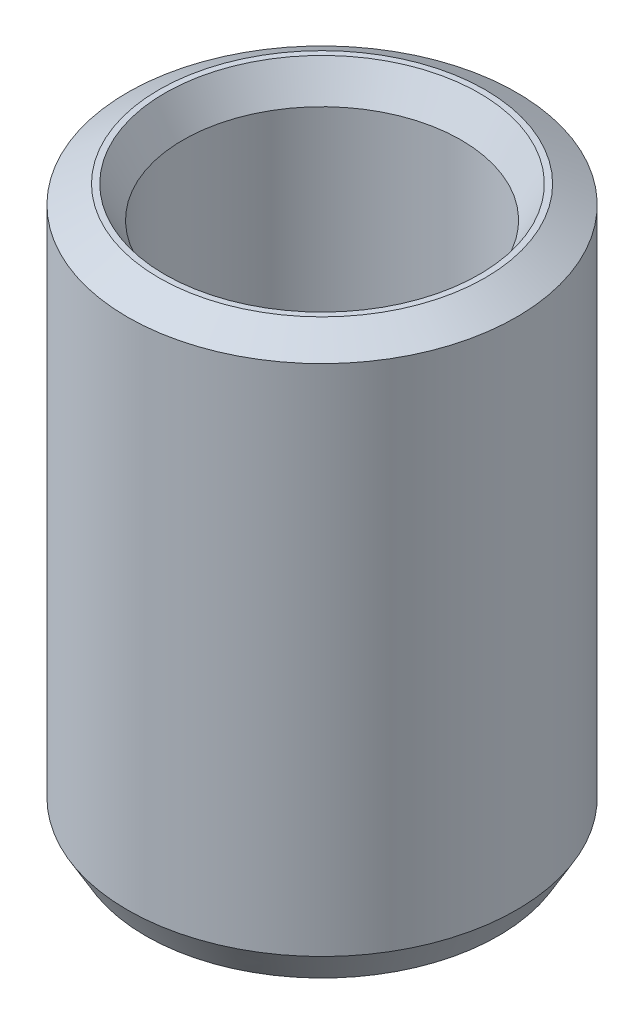
from build123d import *
from OCP.BRepFilletAPI import BRepFilletAPI_MakeChamfer

# Parameters (mm, degrees)
SKETCH1_R           = 22.5
BOSS_EXTRUDE1_DEPTH = 65.127084114
SKETCH2_R           = 16.074473569
CUT_EXTRUDE1_DEPTH  = 73.484736912
CHAMFER1_SIZE       = 2.104682209
CHAMFER1_SIZE2      = 3.64541652


with BuildPart() as part:
    # Sketch1 → Boss-Extrude1 (new body)
    with BuildSketch(Plane(origin=(0, 0, 0), x_dir=(1, 0, 0), z_dir=(0, 1, 0))):
        Circle(SKETCH1_R)
    extrude(amount=BOSS_EXTRUDE1_DEPTH)

    # Sketch2 → Cut-Extrude1 (cut, through all)
    with BuildSketch(Plane(origin=(0, 0, 0), x_dir=(1, 0, 0), z_dir=(0, 1, 0))):
        Circle(SKETCH2_R)
    extrude(amount=CUT_EXTRUDE1_DEPTH, mode=Mode.SUBTRACT)

    # Chamfer1: one chamfer whose edges measure the first distance from different faces: ONE call of the kernel's chamfer builder (chamfer() names one face for all edges)
    chamfer1_edges_1 = [part.edges().sort_by_distance(p)[0] for p in [
        (-16.074473569, 65.127084114, 0),
    ]]
    chamfer1_side_1 = [part.faces().sort_by_distance(p)[0] for p in [
        (-21.863603897, 65.127084114, 0),
    ]]
    chamfer1_edges_2 = [part.edges().sort_by_distance(p)[0] for p in [
        (-16.074473569, 0, 0),
    ]]
    chamfer1_side_2 = [part.faces().sort_by_distance(p)[0] for p in [
        (-16.074473569, 32.563542057, 0),
    ]]
    chamfer1_edges_3 = [part.edges().sort_by_distance(p)[0] for p in [
        (-22.5, 0, 0),
    ]]
    chamfer1_side_3 = [part.faces().sort_by_distance(p)[0] for p in [
        (-21.863603897, 0, 0),
    ]]
    chamfer1_edges_4 = [part.edges().sort_by_distance(p)[0] for p in [
        (-22.5, 65.127084114, 0),
    ]]
    chamfer1_side_4 = [part.faces().sort_by_distance(p)[0] for p in [
        (-22.5, 32.563542057, 0),
    ]]
    chamfer1 = BRepFilletAPI_MakeChamfer(part.part.solid().wrapped)
    for e in chamfer1_edges_1:
        chamfer1.Add(CHAMFER1_SIZE, CHAMFER1_SIZE2, e.wrapped, chamfer1_side_1[0].wrapped)  # the first distance lies on this face
    for e in chamfer1_edges_2:
        chamfer1.Add(CHAMFER1_SIZE, CHAMFER1_SIZE2, e.wrapped, chamfer1_side_2[0].wrapped)  # the first distance lies on this face
    for e in chamfer1_edges_3:
        chamfer1.Add(CHAMFER1_SIZE, CHAMFER1_SIZE2, e.wrapped, chamfer1_side_3[0].wrapped)  # the first distance lies on this face
    for e in chamfer1_edges_4:
        chamfer1.Add(CHAMFER1_SIZE, CHAMFER1_SIZE2, e.wrapped, chamfer1_side_4[0].wrapped)  # the first distance lies on this face
    add(Compound.cast(chamfer1.Shape()), mode=Mode.REPLACE)


solid = part.part
